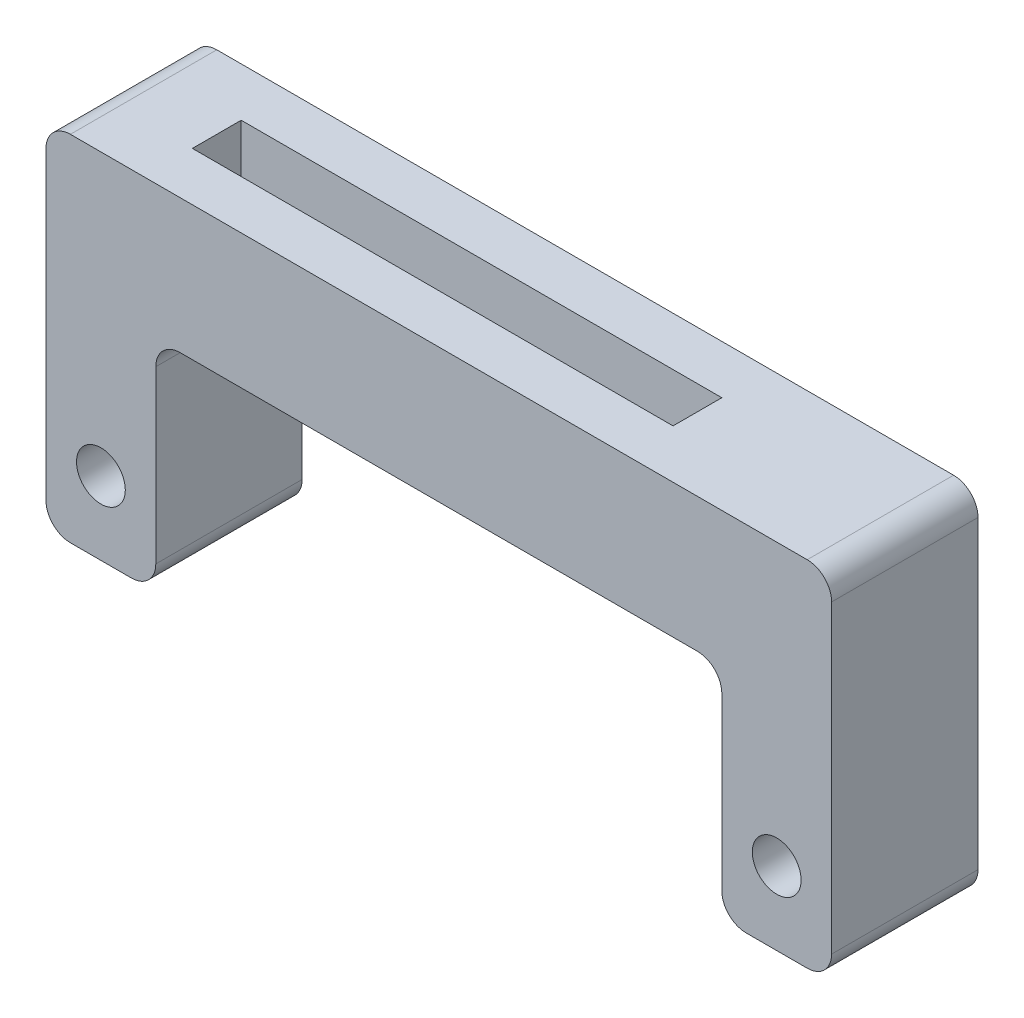
from build123d import *

# Parameters (mm, degrees)
SKETCH2_W           = 32.2
SKETCH2_H           = 14.5
BOSS_EXTRUDE1_DEPTH = 3
SKETCH3_W           = 19.7
SKETCH3_H           = 2
CUT_EXTRUDE1_DEPTH  = 2.5
SKETCH4_W           = 23.2
SKETCH4_H           = 9
CUT_EXTRUDE2_DEPTH  = 19.648659469
SKETCH5_R           = 1
CUT_EXTRUDE3_DEPTH  = 19.648659469
FILLET1_R           = 1


with BuildPart() as part:
    # Sketch2 → Boss-Extrude1 (new, symmetric)
    with BuildSketch(Plane.XY):
        Rectangle(SKETCH2_W, SKETCH2_H)
    extrude(amount=BOSS_EXTRUDE1_DEPTH, both=True)

    # Sketch3 → Cut-Extrude1 (cut)
    with BuildSketch(Plane(origin=(0, 7.25, 0), x_dir=(1, 0, 0), z_dir=(0, 1, 0))):
        with Locations((-2.25, 0)):
            Rectangle(SKETCH3_W, SKETCH3_H)
    extrude(amount=-CUT_EXTRUDE1_DEPTH, mode=Mode.SUBTRACT)

    # Sketch4 → Cut-Extrude2 (cut, through all)
    with BuildSketch(Plane.XY.offset(3)):
        with Locations((0, -2.75)):
            Rectangle(SKETCH4_W, SKETCH4_H)
    extrude(amount=-CUT_EXTRUDE2_DEPTH, mode=Mode.SUBTRACT)

    # Sketch5 → Cut-Extrude3 (cut, through all)
    with BuildSketch(Plane.XY.offset(3)):
        with Locations((-13.85, -4.25)):
            Circle(SKETCH5_R)
        with Locations((13.85, -4.25)):
            Circle(SKETCH5_R)
    extrude(amount=-CUT_EXTRUDE3_DEPTH, mode=Mode.SUBTRACT)

    # Fillet1
    fillet1_edges = [part.edges().sort_by_distance(p)[0] for p in [
        (16.1, 7.25, 0),
        (16.1, -7.25, 0),
        (11.6, -7.25, 0),
        (11.6, 1.75, 0),
        (-11.6, 1.75, 0),
        (-11.6, -7.25, 0),
        (-16.1, -7.25, 0),
        (-16.1, 7.25, 0),
    ]]
    fillet(fillet1_edges, radius=FILLET1_R)


solid = part.part
